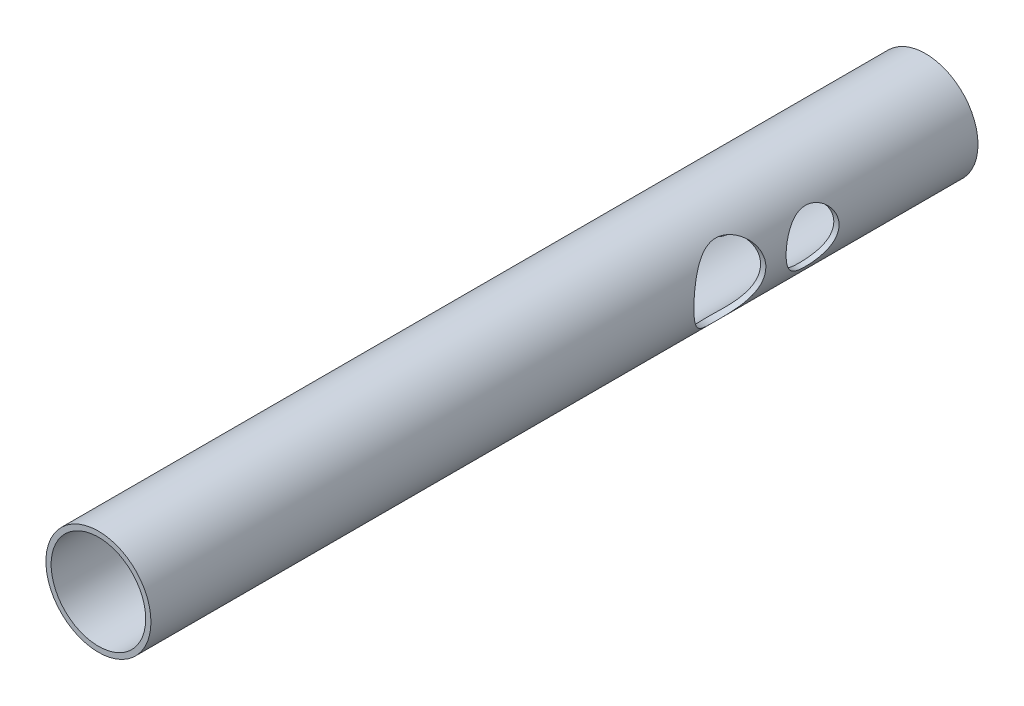
from build123d import *

# Parameters (mm, degrees)
BOSS_EXTRUDE1_DEPTH      = 250
BOSS_EXTRUDE1_DEPTH_BACK = 250
SKETCH1_R                = 31.75
SKETCH1_R_2              = 28.575
SKETCH2_R                = 21.75
SKETCH2_R_2              = 16
CUT_EXTRUDE1_DEPTH       = 255.000246063
SKETCH3_R                = 16
SKETCH3_R_2              = 21.75
CUT_EXTRUDE2_DEPTH       = 255.000246186


with BuildPart() as part:
    # Sketch1 → Boss-Extrude1 (new, two sides: drawn at the far end of the back side and taken through both)
    with BuildSketch(Plane.XY.offset(-BOSS_EXTRUDE1_DEPTH_BACK)):
        Circle(SKETCH1_R)
        Circle(SKETCH1_R_2, mode=Mode.SUBTRACT)
    extrude(amount=BOSS_EXTRUDE1_DEPTH + BOSS_EXTRUDE1_DEPTH_BACK)

    # Sketch2 → Cut-Extrude1 (cut, through all)
    with BuildSketch(Plane(origin=(0, 0, 0), x_dir=(0, 0, -1), z_dir=(1, 0, 0))):
        with Locations((150, 0)):
            Circle(SKETCH2_R)
        with Locations((100, 0)):
            Circle(SKETCH2_R_2)
    extrude(amount=-CUT_EXTRUDE1_DEPTH, mode=Mode.SUBTRACT)

    # Sketch3 → Cut-Extrude2 (cut, through all)
    with BuildSketch(Plane(origin=(0, 0, 0), x_dir=(0, 0, -1), z_dir=(1, 0, 0))):
        with Locations((150, 0)):
            Circle(SKETCH3_R)
        with Locations((100, 0)):
            Circle(SKETCH3_R_2)
    extrude(amount=CUT_EXTRUDE2_DEPTH, mode=Mode.SUBTRACT)


solid = part.part
